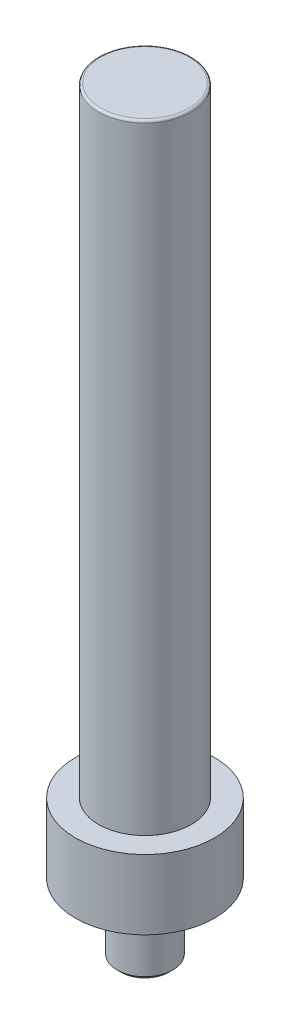
from build123d import *

# Parameters (mm, degrees)
SKETCH1_R           = 15
BOSS_EXTRUDE1_DEPTH = 15
SKETCH2_R           = 10
BOSS_EXTRUDE2_DEPTH = 133.5
SKETCH4_R           = 7.5
BOSS_EXTRUDE3_DEPTH = 15
FILLET1_R           = 0.5


# Read off the part's stored shape, not the designer's step: M12x1.5 Machine Threads Stud1
with BuildPart() as part:
    # Sketch1 → Boss-Extrude1 (new body)
    with BuildSketch(Plane(origin=(0, 0, 0), x_dir=(1, 0, 0), z_dir=(0, 1, 0))):
        with Locations(Location((0, 0, 0), (0, 0, 270))):
            Circle(SKETCH1_R)
    extrude(amount=BOSS_EXTRUDE1_DEPTH)

    # Sketch2 → Boss-Extrude2 (add)
    with BuildSketch(Plane(origin=(0, 15, 0), x_dir=(1, 0, 0), z_dir=(0, 1, 0))):
        with Locations(Location((0, 0, 0), (0, 0, 270))):
            Circle(SKETCH2_R)
    extrude(amount=BOSS_EXTRUDE2_DEPTH)

    # Sketch4 → Boss-Extrude3 (add)
    with BuildSketch(Plane.XZ):
        with Locations(Location((0, 0, 0), (0, 0, 270))):
            Circle(SKETCH4_R)
    extrude(amount=BOSS_EXTRUDE3_DEPTH)

    # M12x1.5 Machine Threads Stud1 outline → M12x1.5 Machine Threads Stud1 (revolve, cut)
    with BuildSketch(Plane.XY):
        Polygon((7.5, 0), (6, 0), (6, -14.172), (5.172, -15), (7.5, -15), align=None)
    revolve(axis=Axis((0, 0, 0), (0, 1, 0)), mode=Mode.SUBTRACT)

    # Fillet1
    fillet1_edges = [part.edges().sort_by_distance(p)[0] for p in [
        (0, 148.5, -10),
    ]]
    fillet(fillet1_edges, radius=FILLET1_R)


solid = part.part
